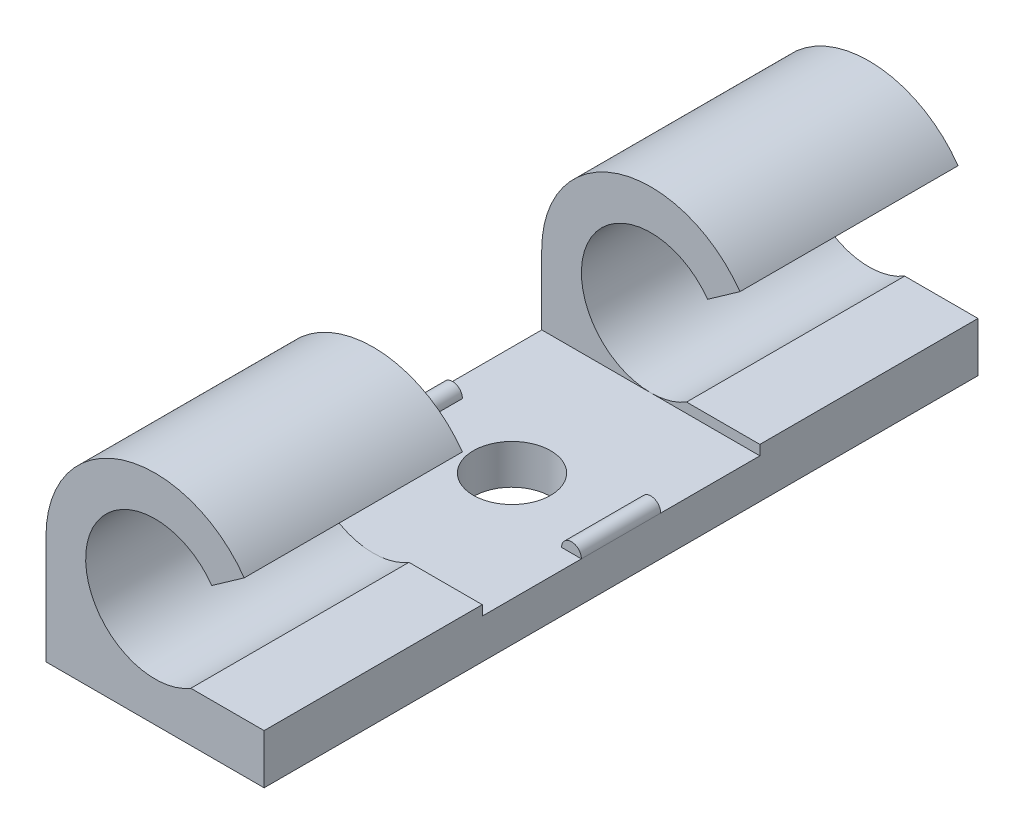
from build123d import *

# Parameters (mm, degrees)
ESBO_O1_R                = 3.5
RESSALTO_EXTRUS_O1_DEPTH = 11
ESBO_O2_W                = 11
ESBO_O2_H                = 2
RESSALTO_EXTRUS_O2_DEPTH = 7
RESSALTO_EXTRUS_O3_DEPTH = 2
ESBO_O4_R                = 1.95
CORTE_EXTRUS_O1_DEPTH    = 2
CORTE_EXTRUS_O2_DEPTH    = 37.830693721


with BuildPart() as part:
    # Esboço1 → Ressalto-extrusão1 (new body)
    with BuildSketch(Plane.XY):
        with BuildLine():
            Line((-5.5, 0), (-5.5, -5.5))
            Line((-5.5, -5.5), (5.5, -5.5))
            Line((5.5, -5.5), (5.5, 0))
            ThreePointArc((5.5, 0), (0, 5.5), (-5.5, 0))
        make_face()
        Circle(ESBO_O1_R, mode=Mode.SUBTRACT)
    ressalto_extrus_o1 = extrude(amount=RESSALTO_EXTRUS_O1_DEPTH)

    # Esboço2 → Ressalto-extrusão2 (add)
    with BuildSketch(Plane.XY.offset(11)):
        with Locations((0, -4.5)):
            Rectangle(ESBO_O2_W, ESBO_O2_H)
    ressalto_extrus_o2 = extrude(amount=RESSALTO_EXTRUS_O2_DEPTH)

    # Esboço3 → Ressalto-extrusão3 (add)
    with BuildSketch(Plane.XY.offset(18)):
        with BuildLine():
            Line((4.5, -3.5), (5.5, -3.5))
            ThreePointArc((5.5, -3.5), (5, -3), (4.5, -3.5))
        make_face()
        with BuildLine():
            Line((-5.5, -3.5), (-4.5, -3.5))
            ThreePointArc((-4.5, -3.5), (-5, -3), (-5.5, -3.5))
        make_face()
    ressalto_extrus_o3 = extrude(amount=-RESSALTO_EXTRUS_O3_DEPTH)

    # Espelhar1: Ressalto-extrusão1, Ressalto-extrusão2, Ressalto-extrusão3 across plane
    add(ressalto_extrus_o1.mirror(Plane(origin=(0, 0, 18), x_dir=(1, 0, 0), z_dir=(0, 0, -1))))
    add(ressalto_extrus_o2.mirror(Plane(origin=(0, 0, 18), x_dir=(1, 0, 0), z_dir=(0, 0, -1))))
    add(ressalto_extrus_o3.mirror(Plane(origin=(0, 0, 18), x_dir=(1, 0, 0), z_dir=(0, 0, -1))))

    # Esboço4 → Corte-extrusão1 (cut)
    with BuildSketch(Plane(origin=(0, -3.5, 0), x_dir=(1, 0, 0), z_dir=(0, 1, 0))):
        with Locations((0, -18)):
            Circle(ESBO_O4_R)
    extrude(amount=-CORTE_EXTRUS_O1_DEPTH, mode=Mode.SUBTRACT)

    # Esboço5 → Corte-extrusão2 (cut, through all)
    with BuildSketch(Plane.XY.offset(36)):
        with BuildLine():
            Line((1.802775638, -3), (5.5, -3))
            Line((5.5, -3), (5.5, 0))
            ThreePointArc((5.5, 0), (5.243074679, 1.661375306), (4.496302579, 3.167532654))
            Line((4.496302579, 3.167532654), (2.861283459, 2.015702598))
            ThreePointArc((2.861283459, 2.015702598), (3.336502069, 1.057238831), (3.5, 0))
            ThreePointArc((3.5, 0), (3.046285831, -1.723410176), (1.802775638, -3))
        make_face()
    extrude(amount=-CORTE_EXTRUS_O2_DEPTH, mode=Mode.SUBTRACT)


solid = part.part
